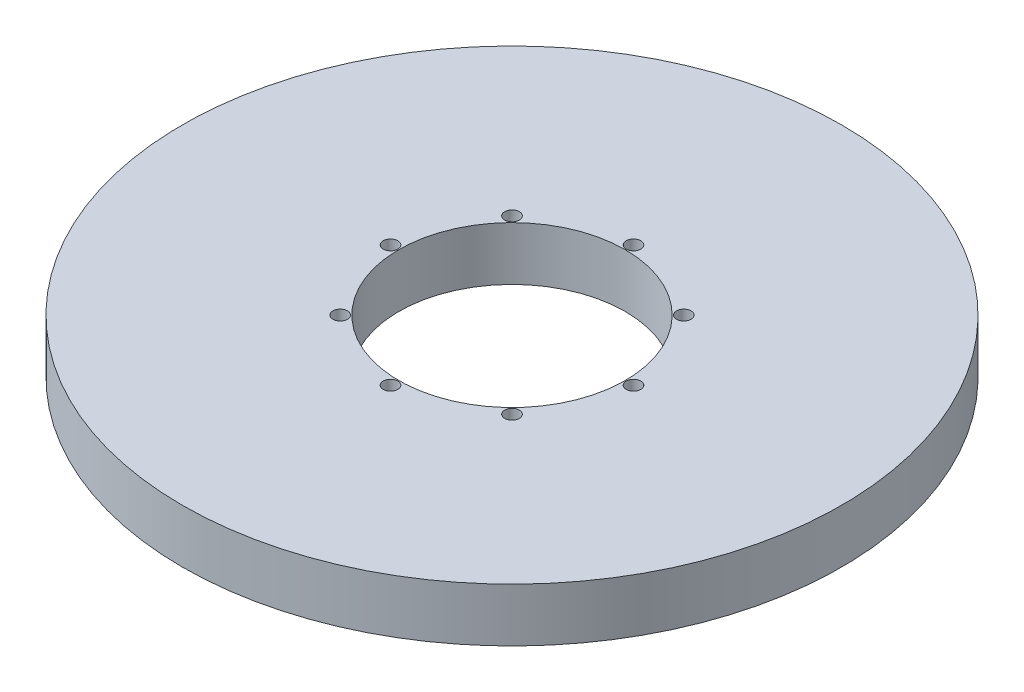
from build123d import *

# Parameters (mm, degrees)
SKETCH1_R           = 80
BOSS_EXTRUDE1_DEPTH = 13
SKETCH2_R           = 27.5
CUT_EXTRUDE1_DEPTH  = 114.881517377
SKETCH3_R           = 1.77324001
CUT_EXTRUDE2_DEPTH  = 12.744097501
CIRPATTERN1_COUNT   = 8


with BuildPart() as part:
    # Sketch1 → Boss-Extrude1 (new body)
    with BuildSketch(Plane(origin=(0, 0, 0), x_dir=(1, 0, 0), z_dir=(0, 1, 0))):
        Circle(SKETCH1_R)
    extrude(amount=BOSS_EXTRUDE1_DEPTH)

    # Sketch2 → Cut-Extrude1 (cut, through all)
    with BuildSketch(Plane(origin=(0, 0, 0), x_dir=(1, 0, 0), z_dir=(0, 1, 0))):
        Circle(SKETCH2_R)
    extrude(amount=CUT_EXTRUDE1_DEPTH, mode=Mode.SUBTRACT)

    # Sketch3 → Cut-Extrude2 (cut)
    with BuildSketch(Plane(origin=(0, 13, 0), x_dir=(1, 0, 0), z_dir=(0, 1, 0))):
        with Locations((-29.492361813, 0)):
            Circle(SKETCH3_R)
    cut_extrude2 = extrude(amount=-CUT_EXTRUDE2_DEPTH, mode=Mode.SUBTRACT)

    # CirPattern1: Cut-Extrude2 ×8 about axis
    cirpattern1_axis = Axis((0, 0, 0), (0, 1, 0))
    for i in range(1, CIRPATTERN1_COUNT):
        add(cut_extrude2.rotate(cirpattern1_axis, i * 360 / CIRPATTERN1_COUNT), mode=Mode.SUBTRACT)


solid = part.part
